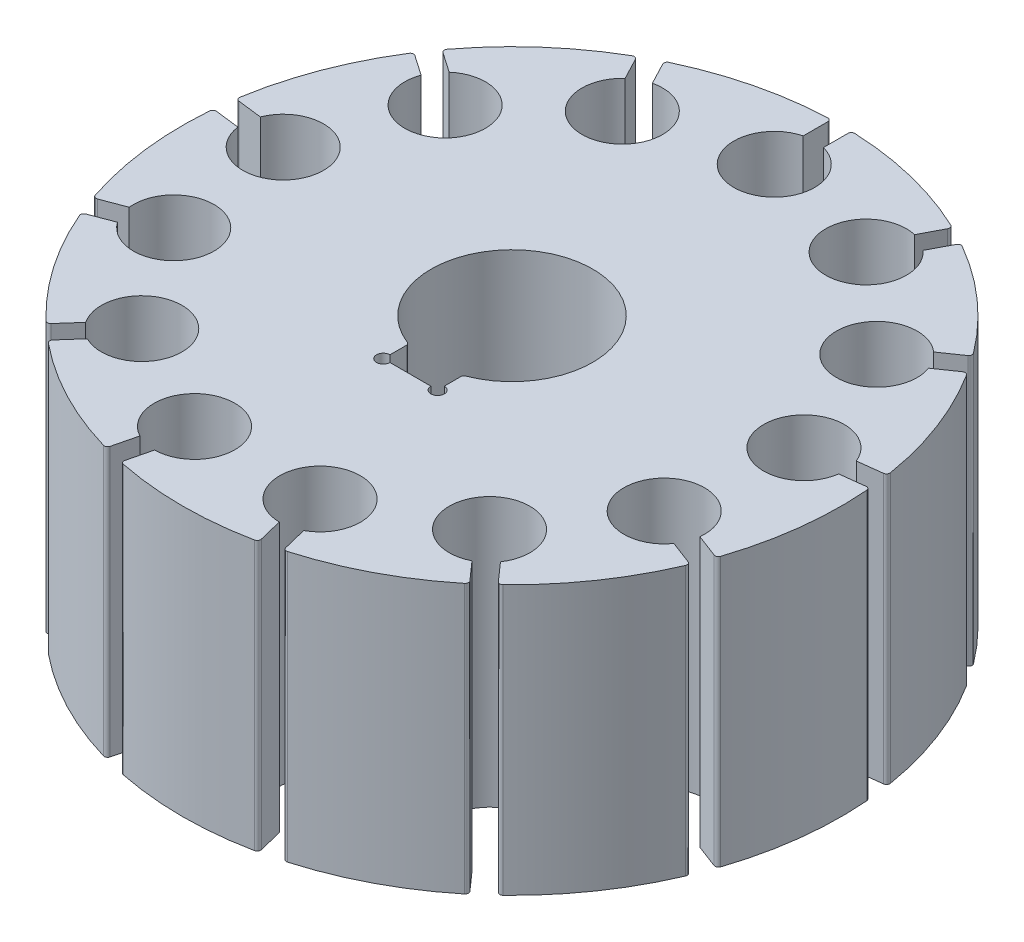
from build123d import *

# Parameters (mm, degrees)
SKETCH1_R           = 24.5
BOSS_EXTRUDE1_DEPTH = 20
SLOT_DEPTH          = 41.006249512
SKETCH4_R           = 0.5
RELIEFS_DEPTH       = 41.006249512
FILLET1_R           = 0.25
CIRPATTERN1_DEPTH   = 20


# Read off the part's stored shape, not the designer's step: CirPattern1
with BuildPart() as part:
    # Sketch1 → Boss-Extrude1 (new body)
    with BuildSketch(Plane(origin=(0, 0, 0), x_dir=(1, 0, 0), z_dir=(0, 1, 0))):
        with Locations(Location((0, 0, 0), (0, 0, 270))):
            Circle(SKETCH1_R)
        with BuildLine():
            Line((2.02, -5.660362179), (2.02, -7.55))
            Line((2.02, -7.55), (-2.02, -7.55))
            Line((-2.02, -7.55), (-2.02, -5.660362179))
            ThreePointArc((-2.02, -5.660362179), (0, 6.01), (2.02, -5.660362179))
        make_face(mode=Mode.SUBTRACT)
    extrude(amount=BOSS_EXTRUDE1_DEPTH)

    # Sketch3 → Slot (cut, through all)
    with BuildSketch(Plane(origin=(0, 20, 0), x_dir=(1, 0, 0), z_dir=(0, 1, 0))):
        with BuildLine():
            Line((0.75, 22.40473751), (0.75, 24.5))
            Line((0.75, 24.5), (-0.75, 24.5))
            Line((-0.75, 24.5), (-0.75, 22.40473751))
            ThreePointArc((-0.75, 22.40473751), (0, 16.5), (0.75, 22.40473751))
        make_face()
    extrude(amount=-SLOT_DEPTH, mode=Mode.SUBTRACT)

    # Sketch4 → Reliefs (cut, through all)
    with BuildSketch(Plane(origin=(0, 20, 0), x_dir=(1, 0, 0), z_dir=(0, 1, 0))):
        with Locations((2.02, -7.55)):
            Circle(SKETCH4_R)
        with Locations((-2.02, -7.55)):
            Circle(SKETCH4_R)
    extrude(amount=-RELIEFS_DEPTH, mode=Mode.SUBTRACT)

    # Fillet1
    fillet1_edges = [part.edges().sort_by_distance(p)[0] for p in [
        (0.75, 10, -24.488517717),
        (-0.75, 10, -24.488517717),
        (-2.02, 10, 5.660362179),
        (2.02, 10, 5.660362179),
    ]]
    fillet(fillet1_edges, radius=FILLET1_R)

    # CirPattern1 outline → CirPattern1 (cut)
    with BuildSketch(Plane(origin=(0, 0, 0), x_dir=(1, 0, 0), z_dir=(0, 1, 0))):
        with BuildLine():
            ThreePointArc((-12.270617331, 21.205705608), (-12.075969293, 21.229484159), (-11.924042943, 21.10550165))
            Line((-11.924042943, 21.10550165), (-11.076092704, 19.489867452))
            ThreePointArc((-11.076092704, 19.489867452), (-7.66793234, 14.610024423), (-9.747908665, 20.18695221))
            Line((-9.747908665, 20.18695221), (-10.595858905, 21.802586408))
            ThreePointArc((-10.595858905, 21.802586408), (-10.611590506, 21.998049435), (-10.481448454, 22.144733873))
            ThreePointArc((-10.481448454, 22.144733873), (-11.385717715, 21.693672628), (-12.270617331, 21.205705608))
        make_face()
        with BuildLine():
            ThreePointArc((11.924042943, 21.10550165), (12.075969293, 21.229484159), (12.270617331, 21.205705608))
            ThreePointArc((12.270617331, 21.205705608), (11.385717715, 21.693672628), (10.481448454, 22.144733873))
            ThreePointArc((10.481448454, 22.144733873), (10.611590506, 21.998049435), (10.595858905, 21.802586408))
            Line((10.595858905, 21.802586408), (9.747908665, 20.18695221))
            ThreePointArc((9.747908665, 20.18695221), (7.66793234, 14.610024423), (11.076092704, 19.489867452))
            Line((11.076092704, 19.489867452), (11.924042943, 21.10550165))
        make_face()
        with BuildLine():
            ThreePointArc((20.366431348, 13.14661455), (20.558572994, 13.185791915), (20.719874829, 13.0742796))
            ThreePointArc((20.719874829, 13.0742796), (20.163104714, 13.917586295), (19.572032661, 14.737216071))
            ThreePointArc((19.572032661, 14.737216071), (19.619100068, 14.546853424), (19.514334228, 14.381090349))
            Line((19.514334228, 14.381090349), (18.01268893, 13.344579438))
            ThreePointArc((18.01268893, 13.344579438), (13.579233788, 9.37306832), (18.86478605, 12.11010364))
            Line((18.86478605, 12.11010364), (20.366431348, 13.14661455))
        make_face()
        with BuildLine():
            ThreePointArc((24.143115774, 2.175996491), (24.331455382, 2.121393649), (24.422458706, 1.947693698))
            ThreePointArc((24.422458706, 1.947693698), (24.321367415, 2.953148666), (24.178900053, 3.95357967))
            ThreePointArc((24.178900053, 3.95357967), (24.132110239, 3.763148603), (23.962310754, 3.665059802))
            Line((23.962310754, 3.665059802), (22.150979237, 3.445124337))
            ThreePointArc((22.150979237, 3.445124337), (16.379696423, 1.988855222), (22.331784258, 1.956061026))
            Line((22.331784258, 1.956061026), (24.143115774, 2.175996491))
        make_face()
        with BuildLine():
            ThreePointArc((22.388903332, -9.293116141), (22.530294567, -9.428990336), (22.530151616, -9.625085358))
            ThreePointArc((22.530151616, -9.625085358), (22.907897946, -8.687819733), (23.246672831, -7.735774188))
            ThreePointArc((23.246672831, -7.735774188), (23.116744778, -7.882648213), (22.920810662, -7.890591777))
            Line((22.920810662, -7.890591777), (21.21474715, -7.243567232))
            ThreePointArc((21.21474715, -7.243567232), (15.427768004, -5.850980635), (20.682839819, -8.646091596))
            Line((20.682839819, -8.646091596), (22.388903332, -9.293116141))
        make_face()
        with BuildLine():
            ThreePointArc((15.505662952, -18.633287859), (15.567714786, -18.819306267), (15.476458308, -18.992873354))
            ThreePointArc((15.476458308, -18.992873354), (16.246505127, -18.33851333), (16.988913016, -17.652955405))
            ThreePointArc((16.988913016, -17.652955405), (16.805611676, -17.722625319), (16.628429074, -17.638603872))
            Line((16.628429074, -17.638603872), (15.418472156, -16.272844842))
            ThreePointArc((15.418472156, -16.272844842), (10.941523861, -12.350427345), (14.295706033, -17.26752883))
            Line((14.295706033, -17.26752883), (15.505662952, -18.633287859))
        make_face()
        with BuildLine():
            ThreePointArc((5.070262053, -23.704797884), (5.038759159, -23.89834593), (4.877294914, -24.009622953))
            ThreePointArc((4.877294914, -24.009622953), (5.863233775, -23.788074527), (6.839197968, -23.52605728))
            ThreePointArc((6.839197968, -23.52605728), (6.644515468, -23.502562546), (6.526674779, -23.345824387))
            Line((6.526674779, -23.345824387), (6.090011003, -21.574209808))
            ThreePointArc((6.090011003, -21.574209808), (3.948708458, -16.020539989), (4.633598277, -21.933183305))
            Line((4.633598277, -21.933183305), (5.070262053, -23.704797884))
        make_face()
        with BuildLine():
            ThreePointArc((-6.526674779, -23.345824387), (-6.644515468, -23.502562546), (-6.839197968, -23.52605728))
            ThreePointArc((-6.839197968, -23.52605728), (-5.863233775, -23.788074527), (-4.877294914, -24.009622953))
            ThreePointArc((-4.877294914, -24.009622953), (-5.038759159, -23.89834593), (-5.070262053, -23.704797884))
            Line((-5.070262053, -23.704797884), (-4.633598277, -21.933183305))
            ThreePointArc((-4.633598277, -21.933183305), (-3.948708458, -16.020539989), (-6.090011003, -21.574209808))
            Line((-6.090011003, -21.574209808), (-6.526674779, -23.345824387))
        make_face()
        with BuildLine():
            ThreePointArc((-16.628429074, -17.638603872), (-16.805611676, -17.722625319), (-16.988913016, -17.652955405))
            ThreePointArc((-16.988913016, -17.652955405), (-16.246505127, -18.33851333), (-15.476458308, -18.992873354))
            ThreePointArc((-15.476458308, -18.992873354), (-15.567714786, -18.819306267), (-15.505662952, -18.633287859))
            Line((-15.505662952, -18.633287859), (-14.295706033, -17.26752883))
            ThreePointArc((-14.295706033, -17.26752883), (-10.941523861, -12.350427345), (-15.418472156, -16.272844842))
            Line((-15.418472156, -16.272844842), (-16.628429074, -17.638603872))
        make_face()
        with BuildLine():
            ThreePointArc((-22.920810662, -7.890591777), (-23.116744778, -7.882648213), (-23.246672831, -7.735774188))
            ThreePointArc((-23.246672831, -7.735774188), (-22.907897946, -8.687819733), (-22.530151616, -9.625085358))
            ThreePointArc((-22.530151616, -9.625085358), (-22.530294567, -9.428990336), (-22.388903332, -9.293116141))
            Line((-22.388903332, -9.293116141), (-20.682839819, -8.646091596))
            ThreePointArc((-20.682839819, -8.646091596), (-15.427768004, -5.850980635), (-21.21474715, -7.243567232))
            Line((-21.21474715, -7.243567232), (-22.920810662, -7.890591777))
        make_face()
        with BuildLine():
            ThreePointArc((-23.962310754, 3.665059802), (-24.132110239, 3.763148603), (-24.178900053, 3.95357967))
            ThreePointArc((-24.178900053, 3.95357967), (-24.321367415, 2.953148666), (-24.422458706, 1.947693698))
            ThreePointArc((-24.422458706, 1.947693698), (-24.331455382, 2.121393649), (-24.143115774, 2.175996491))
            Line((-24.143115774, 2.175996491), (-22.331784258, 1.956061026))
            ThreePointArc((-22.331784258, 1.956061026), (-16.379696423, 1.988855222), (-22.150979237, 3.445124337))
            Line((-22.150979237, 3.445124337), (-23.962310754, 3.665059802))
        make_face()
        with BuildLine():
            ThreePointArc((-19.514334228, 14.381090349), (-19.619100068, 14.546853424), (-19.572032661, 14.737216071))
            ThreePointArc((-19.572032661, 14.737216071), (-20.163104714, 13.917586295), (-20.719874829, 13.0742796))
            ThreePointArc((-20.719874829, 13.0742796), (-20.558572994, 13.185791915), (-20.366431348, 13.14661455))
            Line((-20.366431348, 13.14661455), (-18.86478605, 12.11010364))
            ThreePointArc((-18.86478605, 12.11010364), (-13.579233788, 9.37306832), (-18.01268893, 13.344579438))
            Line((-18.01268893, 13.344579438), (-19.514334228, 14.381090349))
        make_face()
    extrude(amount=CIRPATTERN1_DEPTH, mode=Mode.SUBTRACT)


solid = part.part
